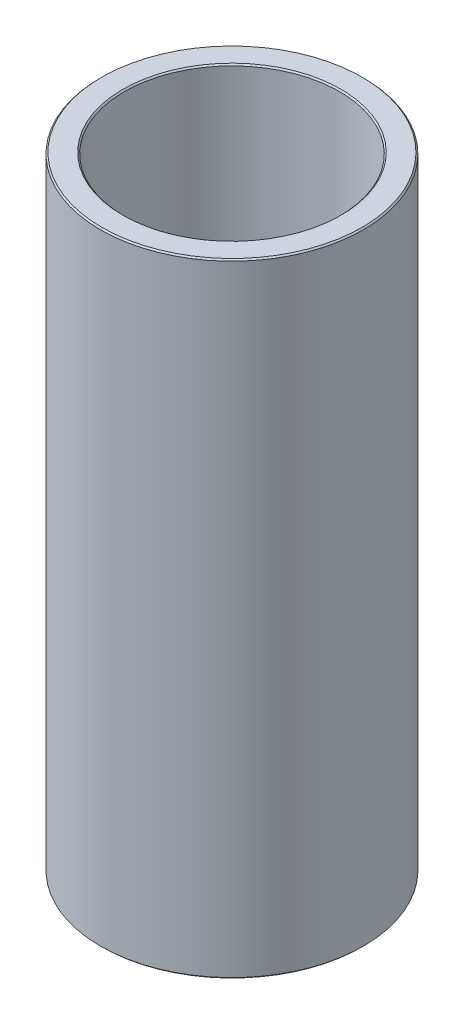
from build123d import *
from OCP.BRepFilletAPI import BRepFilletAPI_MakeChamfer

# Parameters (mm, degrees)
SKETCH1_R           = 55
BOSS_EXTRUDE1_DEPTH = 260.625235347
SKETCH2_R           = 45.0552036
CUT_EXTRUDE1_DEPTH  = 272.984399001
CHAMFER1_SIZE       = 0.584086325
CHAMFER1_SIZE2      = 0.577051638


with BuildPart() as part:
    # Sketch1 → Boss-Extrude1 (new body)
    with BuildSketch(Plane(origin=(0, 0, 0), x_dir=(1, 0, 0), z_dir=(0, 1, 0))):
        Circle(SKETCH1_R)
    extrude(amount=BOSS_EXTRUDE1_DEPTH)

    # Sketch2 → Cut-Extrude1 (cut, through all)
    with BuildSketch(Plane(origin=(0, 0, 0), x_dir=(1, 0, 0), z_dir=(0, 1, 0))):
        Circle(SKETCH2_R)
    extrude(amount=CUT_EXTRUDE1_DEPTH, mode=Mode.SUBTRACT)

    # Chamfer1: one chamfer whose edges measure the first distance from different faces: ONE call of the kernel's chamfer builder (chamfer() names one face for all edges)
    chamfer1_edges_1 = [part.edges().sort_by_distance(p)[0] for p in [
        (-45.0552036, 260.625235347, 0),
    ]]
    chamfer1_side_1 = [part.faces().sort_by_distance(p)[0] for p in [
        (-53.444365081, 260.625235347, 0),
    ]]
    chamfer1_edges_2 = [part.edges().sort_by_distance(p)[0] for p in [
        (-45.0552036, 0, 0),
    ]]
    chamfer1_side_2 = [part.faces().sort_by_distance(p)[0] for p in [
        (-45.0552036, 130.312617674, 0),
    ]]
    chamfer1_edges_3 = [part.edges().sort_by_distance(p)[0] for p in [
        (-55, 0, 0),
    ]]
    chamfer1_side_3 = [part.faces().sort_by_distance(p)[0] for p in [
        (-53.444365081, 0, 0),
    ]]
    chamfer1_edges_4 = [part.edges().sort_by_distance(p)[0] for p in [
        (-55, 260.625235347, 0),
    ]]
    chamfer1_side_4 = [part.faces().sort_by_distance(p)[0] for p in [
        (-55, 130.312617674, 0),
    ]]
    chamfer1 = BRepFilletAPI_MakeChamfer(part.part.solid().wrapped)
    for e in chamfer1_edges_1:
        chamfer1.Add(CHAMFER1_SIZE, CHAMFER1_SIZE2, e.wrapped, chamfer1_side_1[0].wrapped)  # the first distance lies on this face
    for e in chamfer1_edges_2:
        chamfer1.Add(CHAMFER1_SIZE, CHAMFER1_SIZE2, e.wrapped, chamfer1_side_2[0].wrapped)  # the first distance lies on this face
    for e in chamfer1_edges_3:
        chamfer1.Add(CHAMFER1_SIZE, CHAMFER1_SIZE2, e.wrapped, chamfer1_side_3[0].wrapped)  # the first distance lies on this face
    for e in chamfer1_edges_4:
        chamfer1.Add(CHAMFER1_SIZE, CHAMFER1_SIZE2, e.wrapped, chamfer1_side_4[0].wrapped)  # the first distance lies on this face
    add(Compound.cast(chamfer1.Shape()), mode=Mode.REPLACE)


solid = part.part
